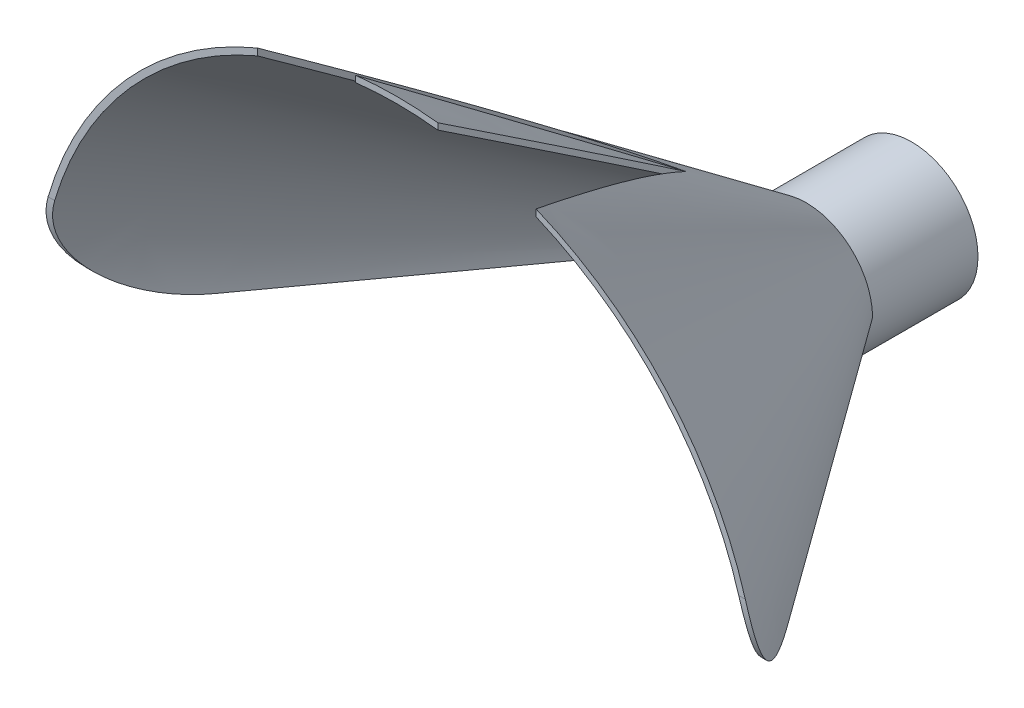
from build123d import *

# Parameters (mm, degrees)
SKETCH1_R            = 6
SKETCH1_R_2          = 3
BOSS_EXTRUDE1_DEPTH  = 10
SHELL1_START         = 10
SHELL1_DEPTH         = 40
SHELL1_2_OUTLINE_R   = 6
SHELL1_2_OUTLINE_R_2 = 3
SHELL1_2_DEPTH       = 10
SHELL1_START_2       = -0.5
SHELL1_3_OUTLINE_R   = 6.5
SHELL1_3_OUTLINE_R_2 = 6
SHELL1_3_OUTLINE_R_3 = 3
SHELL1_3_OUTLINE_R_4 = 2.5
SHELL1_3_DEPTH       = 10.5
SHELL1_4_OUTLINE_R   = 6
SHELL1_4_OUTLINE_R_2 = 3
SHELL1_4_DEPTH       = 0.5
SHELL1_5_DEPTH       = 0.5
SHELL1_START_3       = 9.5
SHELL1_6_DEPTH       = 0.5
SHELL1_8_ANGLE       = 180
SHELL1_9_ANGLE       = 180
FILLET1_R            = 10
CUT_EXTRUDE3_DEPTH   = 50


with BuildPart() as part:
    # Sketch1 → Boss-Extrude1 (new body)
    with BuildSketch(Plane.XY):
        Circle(SKETCH1_R)
        Circle(SKETCH1_R_2, mode=Mode.SUBTRACT)
    extrude(amount=BOSS_EXTRUDE1_DEPTH)

    # Sketch14 → Loft1 section 0
    with BuildSketch(Plane.XY.offset(10)):
        with BuildLine():
            Line((-6, 0), (6, 0))
            ThreePointArc((6, 0), (0, 6), (-6, 0))
        make_face()
    # Sketch13 → Loft1 section 1
    with BuildSketch(Plane.XY.offset(50)):
        with BuildLine():
            Line((-35, 0), (35, 0))
            ThreePointArc((35, 0), (0, 35), (-35, 0))
        make_face()
    loft()

    # Shell1: read off the stored shape, not the designer's step
    # Shell1 outline → Shell1 (cut)
    with BuildSketch(Plane.XY.offset(SHELL1_START)):
        with BuildLine():
            ThreePointArc((6, 0), (0, 6), (-6, 0))
            Line((-6, 0), (6, 0))
        make_face()
    extrude(amount=SHELL1_DEPTH, mode=Mode.SUBTRACT)

    # Shell1 2 outline → Shell1 2 (cut)
    with BuildSketch(Plane.XY):
        Circle(SHELL1_2_OUTLINE_R)
        Circle(SHELL1_2_OUTLINE_R_2, mode=Mode.SUBTRACT)
    extrude(amount=SHELL1_2_DEPTH, mode=Mode.SUBTRACT)

    # Shell1 3 outline → Shell1 3 (add)
    # profile 1 of 2: a face of its own
    with BuildSketch(Plane.XY.offset(SHELL1_START_2)):
        Circle(SHELL1_3_OUTLINE_R)
        Circle(SHELL1_3_OUTLINE_R_2, mode=Mode.SUBTRACT)
    # profile 2 of 2: a face of its own
    with BuildSketch(Plane.XY.offset(SHELL1_START_2)):
        Circle(SHELL1_3_OUTLINE_R_3)
        Circle(SHELL1_3_OUTLINE_R_4, mode=Mode.SUBTRACT)
    extrude(amount=SHELL1_3_DEPTH)

    # Shell1 4 outline → Shell1 4 (add)
    with BuildSketch(Plane.XY.offset(SHELL1_START_2)):
        Circle(SHELL1_4_OUTLINE_R)
        Circle(SHELL1_4_OUTLINE_R_2, mode=Mode.SUBTRACT)
    extrude(amount=SHELL1_4_DEPTH)

    # Shell1 5 outline → Shell1 5 (add)
    with BuildSketch(Plane.XY.offset(SHELL1_START)):
        with BuildLine():
            ThreePointArc((-6.5, 0), (0, -6.5), (6.5, 0))
            Line((6.5, 0), (2.5, 0))
            ThreePointArc((2.5, 0), (0, -2.5), (-2.5, 0))
            Line((-2.5, 0), (-6.5, 0))
        make_face()
    extrude(amount=SHELL1_5_DEPTH)

    # Shell1 6 outline → Shell1 6 (add)
    with BuildSketch(Plane.XY.offset(SHELL1_START_3)):
        with BuildLine():
            ThreePointArc((2.5, 0), (0, 2.5), (-2.5, 0))
            Line((-2.5, 0), (2.5, 0))
        make_face()
    extrude(amount=SHELL1_6_DEPTH)

    # Shell1 7 outline → Shell1 7 (revolve, cut)
    with BuildSketch(Plane.XZ):
        Polygon((35, 49.148164185), (35, 50), (6.5, 50), (6.5, 9.837819357), align=None)
    revolve(axis=Axis((0, 0, 0), (0, 0, 1)), mode=Mode.SUBTRACT)

    # Shell1 8 outline → Shell1 8 (revolve, cut)
    with BuildSketch(Plane.XZ):
        Polygon((6, 50), (6, 10), (6.5, 10.689655172), (6.5, 50), align=None)
    revolve(axis=Axis((0, 0, 0), (0, 0, 1)), revolution_arc=SHELL1_8_ANGLE, mode=Mode.SUBTRACT)

    # Shell1 9 outline → Shell1 9 (revolve)
    with BuildSketch(Plane.XZ):
        Polygon((35.617580966, 50), (35, 50), (6, 10), (6.5, 10), (6.5, 9.837819357), align=None)
    revolve(axis=Axis((0, 0, 0), (0, 0, 1)), revolution_arc=SHELL1_9_ANGLE)

    # Fillet1
    # the kernel refuses this fillet: 10 mm, written as the material it takes off along each edge
    with BuildSketch(Plane(origin=(-60.617580966, 0, 50), x_dir=(0, 1, 0), z_dir=(1, 0, 0))) as fillet1_piece_1:
        with BuildLine():
            CenterArc((FILLET1_R, -FILLET1_R), FILLET1_R, 90, 90)
            Line((0, -FILLET1_R), (-FILLET1_R * 0.02, -FILLET1_R))
            Line((-FILLET1_R * 0.02, -FILLET1_R), (-FILLET1_R * 0.02, FILLET1_R * 0.02))
            Line((-FILLET1_R * 0.02, FILLET1_R * 0.02), (FILLET1_R, FILLET1_R * 0.02))
            Line((FILLET1_R, FILLET1_R * 0.02), (FILLET1_R, 0))
        make_face()
    extrude(amount=50.617580966, mode=Mode.SUBTRACT)
    with BuildSketch(Plane(origin=(60.617580966, 0, 50), x_dir=(0, 1, 0), z_dir=(-1, 0, 0))) as fillet1_piece_2:
        with BuildLine():
            CenterArc((FILLET1_R, FILLET1_R), FILLET1_R, 180, 90)
            Line((0, FILLET1_R), (-FILLET1_R * 0.02, FILLET1_R))
            Line((-FILLET1_R * 0.02, FILLET1_R), (-FILLET1_R * 0.02, -FILLET1_R * 0.02))
            Line((-FILLET1_R * 0.02, -FILLET1_R * 0.02), (FILLET1_R, -FILLET1_R * 0.02))
            Line((FILLET1_R, -FILLET1_R * 0.02), (FILLET1_R, 0))
        make_face()
    extrude(amount=50.617580966, mode=Mode.SUBTRACT)

    # Sketch15 → Cut-Extrude3 (cut)
    with BuildSketch(Plane(origin=(0, 0, 0), x_dir=(1, 0, 0), z_dir=(0, 1, 0))):
        Polygon((0, -21.637444993), (13.666434313, -50), (13.666434313, -54.174020003), (4.619274425, -54.174020003), align=None)
        Polygon((-4.619274425, -54.174020003), (0, -21.637444993), (-13.666434313, -50), (-13.666434313, -54.174020003), align=None)
    extrude(amount=CUT_EXTRUDE3_DEPTH, mode=Mode.SUBTRACT)


with BuildPart() as cut_extrude3_piece_1:
    # of the separate pieces the step leaves, piece 1, a body of its own (cut_extrude3_pieces)
    add(part.part.solids().sort_by_distance((6, 0, 0))[0])


with BuildPart() as cut_extrude3_piece_2:
    # of the separate pieces the step leaves, piece 2, a body of its own (cut_extrude3_pieces)
    add(part.part.solids().sort_by_distance((4.02668151, 34.767597501, 50))[0])


solid = Compound([cut_extrude3_piece_1.part, cut_extrude3_piece_2.part])
